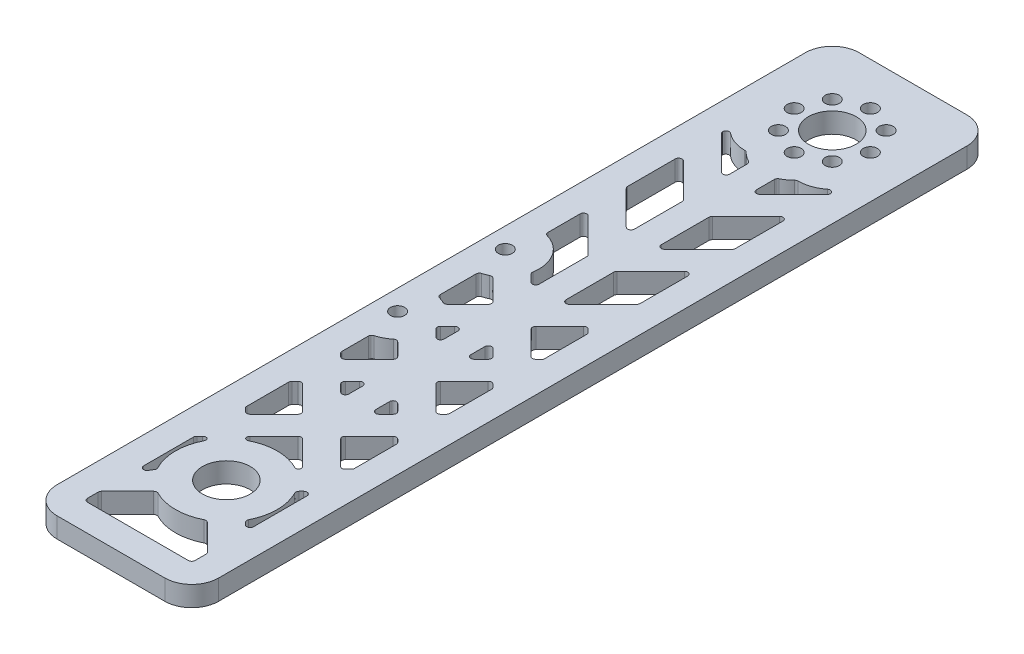
from build123d import *

# Parameters (mm, degrees)
SKETCH1_W           = 48
SKETCH1_H           = 238.294372516
SKETCH1_R           = 7.1
SKETCH1_R_2         = 2.1
BOSS_EXTRUDE1_DEPTH = 6
FILLET2_R           = 8
FILLET3_R           = 1


with BuildPart() as part:
    # Sketch1 → Boss-Extrude1 (new body)
    with BuildSketch(Plane(origin=(0, 0, 0), x_dir=(1, 0, 0), z_dir=(0, 1, 0))):
        Rectangle(SKETCH1_W, SKETCH1_H)
        with Locations(Location((0, 95.147186258, 0), (0, 0, 270))):
            Circle(SKETCH1_R, mode=Mode.SUBTRACT)
        with Locations(Location((0, -84.852813742, 0), (0, 0, 270))):
            Circle(SKETCH1_R, mode=Mode.SUBTRACT)
        with Locations(Location((-8, 103.147186258, 0), (0, 0, 270))):
            Circle(SKETCH1_R_2, mode=Mode.SUBTRACT)
        with Locations(Location((8, 103.147186258, 0), (0, 0, 270))):
            Circle(SKETCH1_R_2, mode=Mode.SUBTRACT)
        with Locations(Location((8, 87.147186258, 0), (0, 0, 270))):
            Circle(SKETCH1_R_2, mode=Mode.SUBTRACT)
        with Locations(Location((-8, 87.147186258, 0), (0, 0, 270))):
            Circle(SKETCH1_R_2, mode=Mode.SUBTRACT)
        with Locations(Location((0, 106.460894757, 0), (0, 0, 270))):
            Circle(SKETCH1_R_2, mode=Mode.SUBTRACT)
        with Locations(Location((11.313708499, 95.147186258, 0), (0, 0, 270))):
            Circle(SKETCH1_R_2, mode=Mode.SUBTRACT)
        with Locations(Location((0, 83.833477759, 0), (0, 0, 270))):
            Circle(SKETCH1_R_2, mode=Mode.SUBTRACT)
        with Locations(Location((-11.313708499, 95.147186258, 0), (0, 0, 270))):
            Circle(SKETCH1_R_2, mode=Mode.SUBTRACT)
        with Locations(Location((-18, 16, 0), (0, 0, 270))):
            Circle(SKETCH1_R_2, mode=Mode.SUBTRACT)
        with Locations(Location((-18, -16, 0), (0, 0, 270))):
            Circle(SKETCH1_R_2, mode=Mode.SUBTRACT)
        with BuildLine():
            Line((-16, 38.627416998), (-4, 26.627416998))
            Line((-4, 26.627416998), (-4, 9.656854249))
            Line((-4, 9.656854249), (-8.142630534, 13.799484784))
            ThreePointArc((-8.142630534, 13.799484784), (-9.529172426, 21.500461818), (-16, 25.9))
            Line((-16, 25.9), (-16, 38.627416998))
        make_face(mode=Mode.SUBTRACT)
        Polygon((-16, 66.911688245), (-16, 49.941125497), (-4, 37.941125497), (-4, 54.911688245), align=None, mode=Mode.SUBTRACT)
        Polygon((4, 54.911688245), (16, 66.911688245), (16, 49.941125497), (4, 37.941125497), align=None, mode=Mode.SUBTRACT)
        Polygon((4, 26.627416998), (16, 38.627416998), (16, 21.656854249), (4, 9.656854249), align=None, mode=Mode.SUBTRACT)
        with BuildLine():
            Line((-16, 78.225396744), (-4, 66.225396744))
            Line((-4, 66.225396744), (-4, 74.559320115))
            ThreePointArc((-4, 74.559320115), (-5.880446939, 75.621879632), (-7.491969734, 77.059971317))
            ThreePointArc((-7.491969734, 77.059971317), (-12.228227026, 77.974831259), (-16, 80.981961201))
            Line((-16, 80.981961201), (-16, 78.225396744))
        make_face(mode=Mode.SUBTRACT)
        with BuildLine():
            Line((4, 74.559320115), (4, 66.225396745))
            Line((4, 66.225396745), (16, 78.225396744))
            Line((16, 78.225396744), (16, 80.981961201))
            ThreePointArc((16, 80.981961201), (12.228227026, 77.974831259), (7.491969734, 77.059971317))
            ThreePointArc((7.491969734, 77.059971317), (5.880446939, 75.621879632), (4, 74.559320115))
        make_face(mode=Mode.SUBTRACT)
        with BuildLine():
            Line((-12.924670593, 7.267816344), (-5.656854249, 0))
            Line((-5.656854249, 0), (-12.924670593, -7.267816344))
            ThreePointArc((-12.924670593, -7.267816344), (-14.414470707, -6.557861487), (-16, -6.1))
            Line((-16, -6.1), (-16, 6.1))
            ThreePointArc((-16, 6.1), (-14.414470707, 6.557861487), (-12.924670593, 7.267816344))
        make_face(mode=Mode.SUBTRACT)
        with BuildLine():
            Line((-16, -25.9), (-16, -34.911688245))
            Line((-16, -34.911688245), (-14.142135624, -36.769552622))
            Line((-14.142135624, -36.769552622), (-5.656854249, -28.284271247))
            Line((-5.656854249, -28.284271247), (-10.828844927, -23.11228057))
            ThreePointArc((-10.828844927, -23.11228057), (-13.207259005, -24.89042371), (-16, -25.9))
        make_face(mode=Mode.SUBTRACT)
        with BuildLine():
            Line((-8.142630534, -13.799484784), (-4, -9.656854249))
            Line((-4, -9.656854249), (-4, -18.627416998))
            Line((-4, -18.627416998), (-7.992702949, -14.634714049))
            ThreePointArc((-7.992702949, -14.634714049), (-8.058891111, -14.21552415), (-8.142630534, -13.799484784))
        make_face(mode=Mode.SUBTRACT)
        Polygon((4, -9.656854249), (4, -18.627416998), (8.485281374, -14.142135624), align=None, mode=Mode.SUBTRACT)
        Polygon((5.656854249, 0), (14.142135624, 8.485281374), (16, 6.627416998), (16, -6.627416998), (14.142135624, -8.485281374), align=None, mode=Mode.SUBTRACT)
        Polygon((14.142135624, -19.798989873), (16, -21.656854249), (16, -34.911688246), (14.142135624, -36.769552622), (5.65685425, -28.284271247), align=None, mode=Mode.SUBTRACT)
        Polygon((-4, -37.941125497), (-8.485281374, -42.426406871), (-4, -46.911688246), align=None, mode=Mode.SUBTRACT)
        Polygon((4, -37.941125497), (4, -46.911688246), (8.485281374, -42.426406871), align=None, mode=Mode.SUBTRACT)
        Polygon((-14.142135624, -48.083261121), (-16, -49.941125497), (-16, -63.195959493), (-14.142135624, -65.053823869), (-5.656854249, -56.568542495), align=None, mode=Mode.SUBTRACT)
        Polygon((5.65685425, -56.568542495), (14.142135624, -48.083261121), (16, -49.941125497), (16, -63.195959493), (14.142135624, -65.053823869), align=None, mode=Mode.SUBTRACT)
        with BuildLine():
            Line((0, -62.225396744), (-8.485281374, -70.710678119))
            Line((-8.485281374, -70.710678119), (-7.467445835, -71.728513658))
            ThreePointArc((-7.467445835, -71.728513658), (0, -69.752813742), (7.467445835, -71.728513658))
            Line((7.467445835, -71.728513658), (8.485281374, -70.710678119))
            Line((8.485281374, -70.710678119), (0, -62.225396744))
        make_face(mode=Mode.SUBTRACT)
        with BuildLine():
            Line((-14.142135624, -76.367532368), (-16, -78.225396744))
            Line((-16, -78.225396744), (-16, -96.852813742))
            Line((-16, -96.852813742), (-13.124300084, -92.320259577))
            ThreePointArc((-13.124300084, -92.320259577), (-15.1, -84.852813742), (-13.124300084, -77.385367908))
            Line((-13.124300084, -77.385367908), (-14.142135624, -76.367532368))
        make_face(mode=Mode.SUBTRACT)
        with BuildLine():
            Line((-16, -106.509667992), (-16, -111.147186258))
            Line((-16, -111.147186258), (16, -111.147186258))
            Line((16, -111.147186258), (16, -106.509667992))
            Line((16, -106.509667992), (7.467445835, -97.977113827))
            ThreePointArc((7.467445835, -97.977113827), (0, -99.952813742), (-7.467445835, -97.977113827))
            Line((-7.467445835, -97.977113827), (-16, -106.509667992))
        make_face(mode=Mode.SUBTRACT)
        with BuildLine():
            Line((13.124300084, -92.320259577), (16, -95.195959493))
            Line((16, -95.195959493), (16, -74.509667992))
            Line((16, -74.509667992), (13.124300084, -77.385367908))
            ThreePointArc((13.124300084, -77.385367908), (15.1, -84.852813742), (13.124300084, -92.320259577))
        make_face(mode=Mode.SUBTRACT)
    extrude(amount=BOSS_EXTRUDE1_DEPTH)

    # Fillet2
    fillet2_edges = [part.edges().sort_by_distance(p)[0] for p in [
        (24, 3, 119.147186258),
        (-24, 3, 119.147186258),
        (-24, 3, -119.147186258),
        (24, 3, -119.147186258),
    ]]
    fillet(fillet2_edges, radius=FILLET2_R)

    # Fillet3
    # the kernel refuses this fillet: 1 mm, written as the material it adds along each edge
    with BuildSketch(Plane(origin=(4, 0, -26.627416998), x_dir=(0.7071067811865454, 0, -0.7071067811865497), z_dir=(0, 1, 0)), Plane(origin=(4, 0, -54.911688245), x_dir=(0.7071067811865486, 0, -0.7071067811865465), z_dir=(0, 1, 0))) as fillet3_piece_1:
        with BuildLine():
            CenterArc((FILLET3_R * 0.414213562373, -FILLET3_R), FILLET3_R, 90, 45)
            Line((-FILLET3_R * 0.292893218813, -FILLET3_R * 0.292893218813), (0, 0))
            Line((0, 0), (FILLET3_R * 0.414213562373, 0))
        make_face()
    fillet3_piece_1_solid = extrude(amount=6, mode=Mode.PRIVATE)
    with BuildSketch(Plane(origin=(4, 0, -9.656854249), x_dir=(0.707106781186546, 0, -0.707106781186549), z_dir=(0, 1, 0)), Plane(origin=(16, 0, -38.627416998), x_dir=(-0.7071067811865454, 0, 0.7071067811865498), z_dir=(0, 1, 0)), Plane(origin=(4, 0, -66.225396745), x_dir=(0.7071067811882165, 0, -0.7071067811848786), z_dir=(0, 1, 0)), Plane(origin=(-4, 0, 18.627416998), x_dir=(0, 0, -1), z_dir=(0, 1, 0)), Plane(origin=(-4, 0, 9.656854249), x_dir=(-0.7071067811848859, 0, 0.7071067811882091), z_dir=(0, 1, 0)), Plane(origin=(4, 0, 18.627416998), x_dir=(0.7071067811884209, 0, -0.7071067811846742), z_dir=(0, 1, 0)), Plane(origin=(-4, 0, 46.911688246), x_dir=(-1.1089107584809617e-11, 0, -1.0), z_dir=(0, 1, 0)), Plane(origin=(4, 0, 46.911688246), x_dir=(0.7071067811814203, 0, -0.7071067811916747), z_dir=(0, 1, 0)), Plane(origin=(16, 0, 95.195959493), x_dir=(0, 0, -1), z_dir=(0, 1, 0)), Plane(origin=(16, 0, 74.509667992), x_dir=(-0.707106781186546, 0, 0.707106781186549), z_dir=(0, 1, 0)), Plane(origin=(-4, 0, -37.941125497), x_dir=(0, 0, -1), z_dir=(0, 1, 0)), Plane(origin=(-16, 0, -38.627416998), x_dir=(0, 0, 1), z_dir=(0, 1, 0)), Plane(origin=(-4, 0, -9.656854249), x_dir=(0, 0, -1), z_dir=(0, 1, 0)), Plane(origin=(-4, 0, -66.225396744), x_dir=(1.1467304207742559e-12, 0, -1.0), z_dir=(0, 1, 0)), Plane(origin=(4, 0, -37.941125497), x_dir=(0.7071067811865454, 0, -0.7071067811865498), z_dir=(0, 1, 0)), Plane(origin=(16, 0, -66.911688245), x_dir=(-0.7071067811865457, 0, 0.7071067811865495), z_dir=(0, 1, 0))) as fillet3_piece_2:
        with BuildLine():
            CenterArc((FILLET3_R * 2.41421356237, FILLET3_R), FILLET3_R, 135, 135)
            Line((FILLET3_R * 1.70710678119, FILLET3_R * 1.70710678119), (0, 0))
            Line((0, 0), (FILLET3_R * 2.41421356237, 0))
        make_face()
    fillet3_piece_2_solid = extrude(amount=6, mode=Mode.PRIVATE)
    with BuildSketch(Plane(origin=(16, 0, -21.656854249), x_dir=(0, 0, -1), z_dir=(0, 1, 0)), Plane(origin=(16, 0, -78.225396744), x_dir=(1.6039007852103696e-12, 0, -1.0), z_dir=(0, 1, 0)), Plane(origin=(-16, 0, 34.911688245), x_dir=(0.7071067811904566, 0, 0.7071067811826386), z_dir=(0, 1, 0)), Plane(origin=(16, 0, -6.627416998), x_dir=(-0.7071067811804654, 0, -0.7071067811926297), z_dir=(0, 1, 0)), Plane(origin=(16, 0, 34.911688246), x_dir=(3.2163785800100783e-12, 0, -1.0), z_dir=(0, 1, 0)), Plane(origin=(16, 0, 21.656854249), x_dir=(-0.7071067811955063, 0, -0.7071067811775889), z_dir=(0, 1, 0)), Plane(origin=(-16, 0, 49.941125497), x_dir=(-1.8097490143208274e-12, 0, 1.0), z_dir=(0, 1, 0)), Plane(origin=(-16, 0, 63.195959493), x_dir=(0.7071067811824949, 0, 0.7071067811906002), z_dir=(0, 1, 0)), Plane(origin=(16, 0, 63.195959493), x_dir=(1.8097490143348284e-12, 0, -1.0), z_dir=(0, 1, 0)), Plane(origin=(16, 0, 49.941125497), x_dir=(-0.7071067811787553, 0, -0.7071067811943397), z_dir=(0, 1, 0)), Plane(origin=(16, 0, 106.509667992), x_dir=(-0.7071067811867683, 0, -0.7071067811863266), z_dir=(0, 1, 0)), Plane(origin=(-16, 0, 106.509667992), x_dir=(0, 0, 1), z_dir=(0, 1, 0)), Plane(origin=(-16, 0, 78.225396744), x_dir=(1.2865514319989333e-12, 0, 1.0), z_dir=(0, 1, 0)), Plane(origin=(-4, 0, -54.911688245), x_dir=(-0.7071067811865486, 0, -0.7071067811865465), z_dir=(0, 1, 0)), Plane(origin=(-16, 0, -49.941125497), x_dir=(0.7071067811865454, 0, 0.7071067811865497), z_dir=(0, 1, 0)), Plane(origin=(-4, 0, -26.627416998), x_dir=(-0.7071067811865518, 0, -0.7071067811865432), z_dir=(0, 1, 0)), Plane(origin=(-16, 0, -78.225396744), x_dir=(0.7071067811882094, 0, 0.7071067811848858), z_dir=(0, 1, 0)), Plane(origin=(16, 0, -49.941125497), x_dir=(0, 0, -1), z_dir=(0, 1, 0))) as fillet3_piece_3:
        with BuildLine():
            CenterArc((FILLET3_R * 0.414213562373, FILLET3_R), FILLET3_R, 225, 45)
            Line((-FILLET3_R * 0.292893218813, FILLET3_R * 0.292893218813), (0, 0))
            Line((0, 0), (FILLET3_R * 0.414213562373, 0))
        make_face()
    fillet3_piece_3_solid = extrude(amount=6, mode=Mode.PRIVATE)
    with BuildSketch(Plane(origin=(7.491969734, 0, -77.059971317), x_dir=(-0.6861937093318866, 0, 0.7274188568310189), z_dir=(0, 1, 0))) as fillet3_piece_4:
        with BuildLine():
            CenterArc((0.448697349, 0.999775997), FILLET3_R, 222.871870134, 45.915375898)
            ThreePointArc((-0.284179668, 0.319414858), (-0.140399543, 0.161211261), (0, 0))
            ThreePointArc((0, 0), (0.21376619, 0.002262431), (0.427532379, 0))
        make_face()
    fillet3_piece_4_solid = extrude(amount=6, mode=Mode.PRIVATE)
    with BuildSketch(Plane(origin=(4, 0, -74.559320115), x_dir=(0.9059260181033782, 0, -0.4234360042832419), z_dir=(0, 1, 0))) as fillet3_piece_5:
        with BuildLine():
            CenterArc((0.63664688, -0.999548982), FILLET3_R, 91.720880387, 63.227411944)
            Line((-0.269279138, -0.576112978), (0, 0))
            ThreePointArc((0, 0), (0.303308183, -0.004555277), (0.606616367, 0))
        make_face()
    fillet3_piece_5_solid = extrude(amount=6, mode=Mode.PRIVATE)
    with BuildSketch(Plane(origin=(16, 0, -80.981961201), x_dir=(-0.6979347910888556, 0, 0.7161613138028019), z_dir=(0, 1, 0))) as fillet3_piece_6:
        with BuildLine():
            CenterArc((2.452026953, 0.993288671), FILLET3_R, 134.261545945, 129.09666466)
            Line((1.754092162, 1.709449984), (0, 0))
            ThreePointArc((0, 0), (1.168182652, 0.067784428), (2.336365304, 0))
        make_face()
    fillet3_piece_6_solid = extrude(amount=6, mode=Mode.PRIVATE)
    with BuildSketch(Plane(origin=(-12.924670593, 0, -7.267816344), x_dir=(-0.8816374422841248, 0, 0.47192734648747214), z_dir=(0, 1, 0))) as fillet3_piece_7:
        with BuildLine():
            CenterArc((0.742302625, 0.999386812), FILLET3_R, 196.840522335, 71.152897345)
            Line((-0.214812216, 0.709678025), (0, 0))
            ThreePointArc((0, 0), (0.353644175, 0.006193196), (0.70728835, 0))
        make_face()
    fillet3_piece_7_solid = extrude(amount=6, mode=Mode.PRIVATE)
    with BuildSketch(Plane(origin=(-16, 0, -6.1), x_dir=(0, 0, 1), z_dir=(0, 1, 0))) as fillet3_piece_8:
        with BuildLine():
            CenterArc((0.786907878, 1), FILLET3_R, 195.680350135, 74.319649865)
            ThreePointArc((-0.175876615, 0.72972973), (-0.081156839, 0.366499308), (0, 0))
            Line((0, 0), (0.786907878, 0))
        make_face()
    fillet3_piece_8_solid = extrude(amount=6, mode=Mode.PRIVATE)
    with BuildSketch(Plane(origin=(-16, 0, 6.1), x_dir=(0, 0, -1), z_dir=(0, 1, 0))) as fillet3_piece_9:
        with BuildLine():
            CenterArc((0.786907878, -1), FILLET3_R, 90, 74.319649865)
            ThreePointArc((-0.175876615, -0.72972973), (-0.081156839, -0.366499308), (0, 0))
            Line((0, 0), (0.786907878, 0))
        make_face()
    fillet3_piece_9_solid = extrude(amount=6, mode=Mode.PRIVATE)
    with BuildSketch(Plane(origin=(-12.924670593, 0, 7.267816344), x_dir=(0.7071067811915731, 0, -0.7071067811815219), z_dir=(0, 1, 0))) as fillet3_piece_10:
        with BuildLine():
            CenterArc((0.741476357, 1), FILLET3_R, 198.847102656, 71.152897344)
            ThreePointArc((-0.20490765, 0.676956177), (-0.096526225, 0.340272312), (0, 0))
            Line((0, 0), (0.741476357, 0))
        make_face()
    fillet3_piece_10_solid = extrude(amount=6, mode=Mode.PRIVATE)
    with BuildSketch(Plane(origin=(-5.656854249, 0, 0), x_dir=(-0.7071067811878301, 0, -0.7071067811852652), z_dir=(0, 1, 0)), Plane(origin=(-14.142135624, 0, 36.769552622), x_dir=(0.7071067811883257, 0, -0.7071067811847694), z_dir=(0, 1, 0)), Plane(origin=(-5.656854249, 0, 28.284271247), x_dir=(-0.707106781187295, 0, -0.7071067811858002), z_dir=(0, 1, 0)), Plane(origin=(8.485281374, 0, 14.142135624), x_dir=(-0.7071067811850603, 0, -0.7071067811880348), z_dir=(0, 1, 0)), Plane(origin=(14.142135624, 0, 8.485281374), x_dir=(0.7071067811851434, 0, -0.7071067811879518), z_dir=(0, 1, 0)), Plane(origin=(14.142135624, 0, -8.485281374), x_dir=(-0.7071067811876279, 0, 0.707106781185467), z_dir=(0, 1, 0)), Plane(origin=(14.142135624, 0, 36.769552622), x_dir=(0.7071067811827018, 0, -0.7071067811903934), z_dir=(0, 1, 0)), Plane(origin=(5.65685425, 0, 28.284271247), x_dir=(0.7071067811830508, 0, 0.7071067811900443), z_dir=(0, 1, 0)), Plane(origin=(-8.485281374, 0, 42.426406871), x_dir=(0.7071067811805768, 0, 0.7071067811925184), z_dir=(0, 1, 0)), Plane(origin=(8.485281374, 0, 42.426406871), x_dir=(-0.7071067811893693, 0, -0.7071067811837258), z_dir=(0, 1, 0)), Plane(origin=(-5.656854249, 0, 56.568542495), x_dir=(-0.7071067811835876, 0, -0.7071067811895073), z_dir=(0, 1, 0)), Plane(origin=(-14.142135624, 0, 65.053823869), x_dir=(0.7071067811883248, 0, -0.7071067811847703), z_dir=(0, 1, 0)), Plane(origin=(-16, 0, 111.147186258), x_dir=(1, 0, 0), z_dir=(0, 1, 0)), Plane(origin=(14.142135624, 0, 65.053823869), x_dir=(0.7071067811865493, 0, -0.7071067811865458), z_dir=(0, 1, 0)), Plane(origin=(16, 0, 111.147186258), x_dir=(0, 0, -1), z_dir=(0, 1, 0)), Plane(origin=(14.142135624, 0, 48.083261121), x_dir=(-0.7071067811877315, 0, 0.7071067811853636), z_dir=(0, 1, 0)), Plane(origin=(8.485281374, 0, 70.710678119), x_dir=(-0.7071067811868678, 0, -0.7071067811862274), z_dir=(0, 1, 0)), Plane(origin=(0, 0, 62.225396744), x_dir=(-0.7071067811851413, 0, 0.7071067811879538), z_dir=(0, 1, 0)), Plane(origin=(-8.485281374, 0, 70.710678119), x_dir=(0.7071067811980486, 0, 0.7071067811750466), z_dir=(0, 1, 0)), Plane(origin=(-14.142135624, 0, 76.367532368), x_dir=(-0.7071067811815027, 0, 0.7071067811915924), z_dir=(0, 1, 0))) as fillet3_piece_11:
        with BuildLine():
            CenterArc((FILLET3_R, FILLET3_R), FILLET3_R, 179.999999999, 90.000000001)
            Line((0, FILLET3_R), (0, 0))
            Line((0, 0), (FILLET3_R, 0))
        make_face()
    fillet3_piece_11_solid = extrude(amount=6, mode=Mode.PRIVATE)
    with BuildSketch(Plane(origin=(-10.828844927, 0, 23.11228057), x_dir=(-0.7356060120642859, 0, 0.6774096212889789), z_dir=(0, 1, 0))) as fillet3_piece_12:
        with BuildLine():
            CenterArc((0.959704055, 0.998974831), FILLET3_R, 182.358448163, 85.046939103)
            Line((-0.039448882, 0.957823768), (0, 0))
            ThreePointArc((0, 0), (0.457217498, 0.01035421), (0.914434996, 0))
        make_face()
    fillet3_piece_12_solid = extrude(amount=6, mode=Mode.PRIVATE)
    with BuildSketch(Plane(origin=(-16, 0, 25.9), x_dir=(0.9721626892314443, 0, -0.2343068621835183), z_dir=(0, 1, 0))) as fillet3_piece_13:
        with BuildLine():
            CenterArc((0.787784773, -0.999309341), FILLET3_R, 92.12958193, 74.319649865)
            Line((-0.184377916, -0.765002479), (0, 0))
            ThreePointArc((0, 0), (0.375312557, -0.006975652), (0.750625114, 0))
        make_face()
    fillet3_piece_13_solid = extrude(amount=6, mode=Mode.PRIVATE)
    with BuildSketch(Plane(origin=(-7.992702949, 0, 14.634714049), x_dir=(0.7071067811880096, 0, 0.7071067811850855), z_dir=(0, 1, 0))) as fillet3_piece_14:
        with BuildLine():
            CenterArc((0.328035248, 1), FILLET3_R, 234.544008458, 35.455991542)
            ThreePointArc((-0.252042221, 0.185438688), (-0.125302928, 0.093695474), (0, 0))
            Line((0, 0), (0.328035248, 0))
        make_face()
    fillet3_piece_14_solid = extrude(amount=6, mode=Mode.PRIVATE)
    with BuildSketch(Plane(origin=(-8.142630534, 0, 13.799484784), x_dir=(0.707106781184885, 0, -0.7071067811882099), z_dir=(0, 1, 0))) as fillet3_piece_15:
        with BuildLine():
            CenterArc((0.532919521, -1), FILLET3_R, 90, 54.70003838)
            ThreePointArc((-0.283218456, -0.422142922), (-0.138952924, -0.212853593), (0, 0))
            Line((0, 0), (0.532919521, 0))
        make_face()
    fillet3_piece_15_solid = extrude(amount=6, mode=Mode.PRIVATE)
    with BuildSketch(Plane(origin=(4, 0, 9.656854249), x_dir=(0.7071067811850604, 0, 0.7071067811880345), z_dir=(0, 1, 0)), Plane(origin=(-4, 0, 37.941125497), x_dir=(1.1089107585405864e-11, 0, 1.0), z_dir=(0, 1, 0)), Plane(origin=(4, 0, 37.941125497), x_dir=(0.7071067811893688, 0, 0.7071067811837263), z_dir=(0, 1, 0)), Plane(origin=(-16, 0, -66.911688245), x_dir=(0.707106781186549, 0, 0.7071067811865461), z_dir=(0, 1, 0))) as fillet3_piece_16:
        with BuildLine():
            CenterArc((FILLET3_R * 2.41421356238, -FILLET3_R), FILLET3_R, 90, 135)
            Line((FILLET3_R * 1.7071067812, -FILLET3_R * 1.70710678119), (0, 0))
            Line((0, 0), (FILLET3_R * 2.41421356238, 0))
        make_face()
    fillet3_piece_16_solid = extrude(amount=6, mode=Mode.PRIVATE)
    with BuildSketch(Plane(origin=(5.656854249, 0, 0), x_dir=(0.7071067811876287, 0, -0.7071067811854663), z_dir=(0, 1, 0)), Plane(origin=(14.142135624, 0, 19.798989873), x_dir=(0.7071067811955066, 0, 0.7071067811775885), z_dir=(0, 1, 0)), Plane(origin=(-14.142135624, 0, 48.083261121), x_dir=(0.7071067811835854, 0, 0.7071067811895095), z_dir=(0, 1, 0)), Plane(origin=(5.65685425, 0, 56.568542495), x_dir=(0.7071067811877327, 0, -0.7071067811853622), z_dir=(0, 1, 0))) as fillet3_piece_17:
        with BuildLine():
            CenterArc((FILLET3_R, -FILLET3_R), FILLET3_R, 90, 90)
            Line((0, -FILLET3_R), (0, 0))
            Line((0, 0), (FILLET3_R, 0))
        make_face()
    fillet3_piece_17_solid = extrude(amount=6, mode=Mode.PRIVATE)
    with BuildSketch(Plane(origin=(7.467445835, 0, 97.977113827), x_dir=(-0.8807005497910464, 0, 0.4736734546053308), z_dir=(0, 1, 0)), Plane(origin=(-7.467445835, 0, 71.728513658), x_dir=(0.8807005497908599, 0, -0.473673454605678), z_dir=(0, 1, 0)), Plane(origin=(13.124300084, 0, 77.385367908), x_dir=(0.4736734546053339, 0, 0.8807005497910448), z_dir=(0, 1, 0))) as fillet3_piece_18:
        with BuildLine():
            CenterArc((0.743740005, 0.999715839), FILLET3_R, 196.726986119, 71.907077979)
            Line((-0.213947038, 0.71190422), (0, 0))
            ThreePointArc((0, 0), (0.359951092, 0.004290834), (0.719902184, 0))
        make_face()
    fillet3_piece_18_solid = extrude(amount=6, mode=Mode.PRIVATE)
    with BuildSketch(Plane(origin=(-7.467445835, 0, 97.977113827), x_dir=(0.8807005497910525, 0, 0.4736734546053197), z_dir=(0, 1, 0)), Plane(origin=(7.467445835, 0, 71.728513658), x_dir=(-0.8807005497910471, 0, -0.47367345460532984), z_dir=(0, 1, 0)), Plane(origin=(-13.124300084, 0, 77.385367908), x_dir=(-0.4736734546051403, 0, 0.8807005497911491), z_dir=(0, 1, 0)), Plane(origin=(13.124300084, 0, 92.320259577), x_dir=(0.47367345460525867, 0, -0.8807005497910853), z_dir=(0, 1, 0))) as fillet3_piece_19:
        with BuildLine():
            CenterArc((0.743740005, -0.999715839), FILLET3_R, 91.365935901, 71.907077979)
            Line((-0.213947038, -0.71190422), (0, 0))
            ThreePointArc((0, 0), (0.359951092, -0.004290834), (0.719902184, 0))
        make_face()
    fillet3_piece_19_solid = extrude(amount=6, mode=Mode.PRIVATE)
    with BuildSketch(Plane(origin=(-16, 0, 96.852813742), x_dir=(0.5357276604383326, 0, -0.8443908300314912), z_dir=(0, 1, 0))) as fillet3_piece_20:
        with BuildLine():
            CenterArc((FILLET3_R * 3.44277692983, FILLET3_R), FILLET3_R, 122.393273018, 147.606726982)
            Line((FILLET3_R * 2.90704926939, FILLET3_R * 1.84439083003), (0, 0))
            Line((0, 0), (FILLET3_R * 3.44277692983, 0))
        make_face()
    fillet3_piece_20_solid = extrude(amount=6, mode=Mode.PRIVATE)
    with BuildSketch(Plane(origin=(-13.124300084, 0, 92.320259577), x_dir=(-0.47804860808671545, 0, -0.8783333810725594), z_dir=(0, 1, 0))) as fillet3_piece_21:
        with BuildLine():
            CenterArc((0.588571596, 0.99982205), FILLET3_R, 209.048696073, 59.870385054)
            Line((-0.285635753, 0.51426926), (0, 0))
            ThreePointArc((0, 0), (0.284853561, 0.002687045), (0.569707121, 0))
        make_face()
    fillet3_piece_21_solid = extrude(amount=6, mode=Mode.PRIVATE)
    with BuildSketch(Plane(origin=(-16, 0, -25.9), x_dir=(0.9721626892314503, 0, 0.23430686218349395), z_dir=(0, 1, 0))) as fillet3_piece_22:
        with BuildLine():
            CenterArc((0.787784773, 0.999309341), FILLET3_R, 193.550768205, 74.319649865)
            Line((-0.184377916, 0.765002479), (0, 0))
            ThreePointArc((0, 0), (0.375312557, 0.006975652), (0.750625114, 0))
        make_face()
    fillet3_piece_22_solid = extrude(amount=6, mode=Mode.PRIVATE)
    with BuildSketch(Plane(origin=(-8.142630534, 0, -13.799484784), x_dir=(0.19324261805678833, 0, -0.9811510029381605), z_dir=(0, 1, 0))) as fillet3_piece_23:
        with BuildLine():
            CenterArc((0.533513383, -0.999683293), FILLET3_R, 91.442042104, 54.70003838)
            Line((-0.29690831, -0.442547931), (0, 0))
            ThreePointArc((0, 0), (0.254173829, -0.003198741), (0.508347657, 0))
        make_face()
    fillet3_piece_23_solid = extrude(amount=6, mode=Mode.PRIVATE)
    with BuildSketch(Plane(origin=(-16, 0, -80.981961201), x_dir=(6.765146397320799e-12, 0, 1.0), z_dir=(0, 1, 0))) as fillet3_piece_24:
        with BuildLine():
            CenterArc((2.449297565, 1), FILLET3_R, 140.90333534, 129.09666466)
            ThreePointArc((1.673214446, 1.630630631), (0.883916333, 0.766770731), (0, 0))
            Line((0, 0), (2.449297565, 0))
        make_face()
    fillet3_piece_24_solid = extrude(amount=6, mode=Mode.PRIVATE)
    with BuildSketch(Plane(origin=(-4, 0, -74.559320115), x_dir=(-0.905926018103428, 0, -0.4234360042831356), z_dir=(0, 1, 0))) as fillet3_piece_25:
        with BuildLine():
            CenterArc((0.63664688, 0.999548982), FILLET3_R, 205.051707669, 63.227411944)
            Line((-0.269279138, 0.576112978), (0, 0))
            ThreePointArc((0, 0), (0.303308183, 0.004555277), (0.606616367, 0))
        make_face()
    fillet3_piece_25_solid = extrude(amount=6, mode=Mode.PRIVATE)
    with BuildSketch(Plane(origin=(-7.491969734, 0, -77.059971317), x_dir=(0.6861937093318864, 0, 0.7274188568310189), z_dir=(0, 1, 0))) as fillet3_piece_26:
        with BuildLine():
            CenterArc((0.448697349, -0.999775997), FILLET3_R, 91.212753968, 45.915375898)
            ThreePointArc((-0.284179668, -0.319414858), (-0.140399543, -0.161211261), (0, 0))
            ThreePointArc((0, 0), (0.21376619, -0.002262431), (0.427532379, 0))
        make_face()
    fillet3_piece_26_solid = extrude(amount=6, mode=Mode.PRIVATE)
    add([fillet3_piece_1_solid, fillet3_piece_2_solid, fillet3_piece_3_solid, fillet3_piece_4_solid, fillet3_piece_5_solid, fillet3_piece_6_solid, fillet3_piece_7_solid, fillet3_piece_8_solid, fillet3_piece_9_solid, fillet3_piece_10_solid, fillet3_piece_11_solid, fillet3_piece_12_solid, fillet3_piece_13_solid, fillet3_piece_14_solid, fillet3_piece_15_solid, fillet3_piece_16_solid, fillet3_piece_17_solid, fillet3_piece_18_solid, fillet3_piece_19_solid, fillet3_piece_20_solid, fillet3_piece_21_solid, fillet3_piece_22_solid, fillet3_piece_23_solid, fillet3_piece_24_solid, fillet3_piece_25_solid, fillet3_piece_26_solid])


solid = part.part
